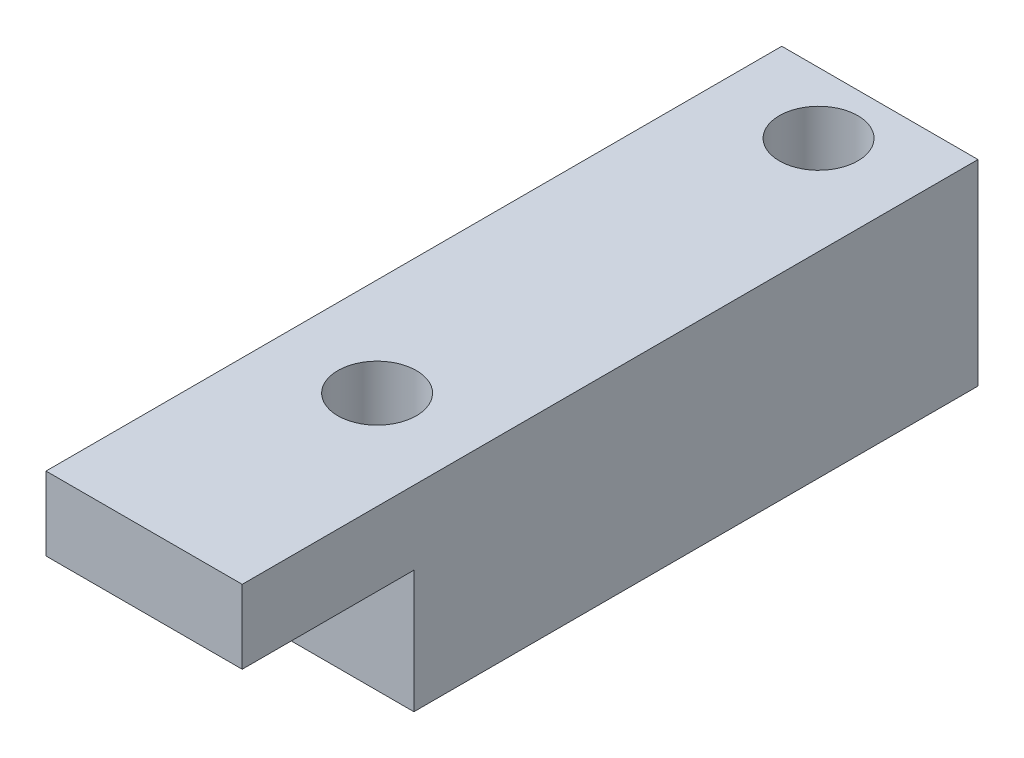
from build123d import *

# Parameters (mm, degrees)
SKETCH1_W           = 8
SKETCH1_H           = 23
SKETCH1_R           = 1.6
BOSS_EXTRUDE1_DEPTH = 5
SKETCH2_R           = 1.6
BOSS_EXTRUDE2_DEPTH = 3


with BuildPart() as part:
    # Sketch1 → Boss-Extrude1 (new body)
    with BuildSketch(Plane(origin=(0, 0, 0), x_dir=(1, 0, 0), z_dir=(0, 1, 0))):
        Rectangle(SKETCH1_W, SKETCH1_H)
        with Locations((0, 9)):
            Circle(SKETCH1_R, mode=Mode.SUBTRACT)
        with Locations((0, -9)):
            Circle(SKETCH1_R, mode=Mode.SUBTRACT)
    extrude(amount=BOSS_EXTRUDE1_DEPTH)

    # Sketch2 → Boss-Extrude2 (add)
    with BuildSketch(Plane(origin=(0, 5, 0), x_dir=(1, 0, 0), z_dir=(0, 1, 0))):
        Polygon((-4, -11.5), (-4, -18.5), (4, -18.5), (4, -11.5), (4, 11.5), (-4, 11.5), align=None)
        with Locations((0, 9)):
            Circle(SKETCH2_R, mode=Mode.SUBTRACT)
        with Locations((0, -9)):
            Circle(SKETCH2_R, mode=Mode.SUBTRACT)
    extrude(amount=BOSS_EXTRUDE2_DEPTH)


solid = part.part
